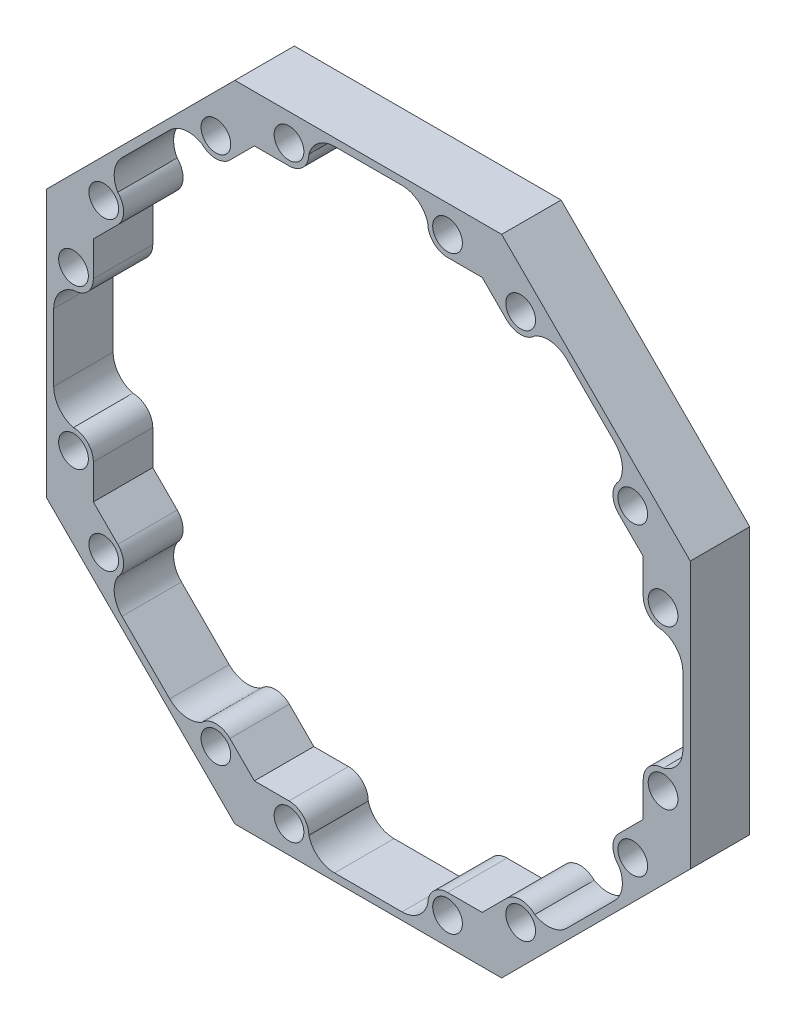
from build123d import *

# Parameters (mm, degrees)
RESSALTO_EXTRUS_O1_DEPTH = 2.5
ESBO_O4_R                = 3
ESBO_O4_R_2              = 0.6604
CORTE_EXTRUS_O1_DEPTH    = 5
ESBO_O5_W                = 2.8
ESBO_O5_H                = 2.8
CORTE_EXTRUS_O2_DEPTH    = 90.837353033
ESBO_O6_R                = 0.6604
CORTE_EXTRUS_O3_DEPTH    = 90.837353033
ESBO_O9_R                = 4
RESSALTO_EXTRUS_O2_DEPTH = 2.5
CORTE_EXTRUS_O4_DEPTH    = 90.837353033
ESBO_O11_R               = 4
CORTE_EXTRUS_O5_DEPTH    = 90.837353033
RESSALTO_EXTRUS_O4_DEPTH = 12
ESBO_O16_R               = 92.783472713
CORTE_EXTRUS_O9_DEPTH    = 12
CORTE_EXTRUS_O10_DEPTH   = 91.600772624
RESSALTO_EXTRUS_O5_DEPTH = 12
ESBO_O18_W               = 2.8
ESBO_O18_H               = 2.8
CORTE_EXTRUS_O13_DEPTH   = 91.600772624
CORTE_EXTRUS_O14_DEPTH   = 91.600772624
ESBO_O23_R               = 3
CORTE_EXTRUS_O16_DEPTH   = 5
ESBO_O24_W               = 24.000132914
ESBO_O24_H               = 6.832493105
ESBO_O24_W_2             = 6.832493105
ESBO_O24_H_2             = 24.000132914
CORTE_EXTRUS_O17_DEPTH   = 91.600772624
RESSALTO_EXTRUS_O6_DEPTH = 12
RESSALTO_EXTRUS_O7_DEPTH = 12


with BuildPart() as part:
    # Esboço1 → Ressalto-extrusão1 (new body)
    with BuildSketch(Plane.XY):
        Polygon((63.5, -26.302561211), (63.5, 26.302561211), (26.302561211, 63.5), (-26.302561211, 63.5), (-63.5, 26.302561211), (-63.5, -26.302561211), (-26.302561211, -63.5), (26.302561211, -63.5), align=None)
    extrude(amount=RESSALTO_EXTRUS_O1_DEPTH)

    # Esboço4 → Corte-extrusão1 (cut)
    with BuildSketch(Plane(origin=(0, 0, 0), x_dir=(-1, 0, 0), z_dir=(0, 0, -1))):
        Circle(ESBO_O4_R)
        with Locations((0, -12.88)):
            Circle(ESBO_O4_R_2)
        with Locations((0, 12.88)):
            Circle(ESBO_O4_R_2)
    extrude(amount=-CORTE_EXTRUS_O1_DEPTH, mode=Mode.SUBTRACT)

    # Esboço5 → Corte-extrusão2 (cut, through all)
    with BuildSketch(Plane.XY):
        Polygon((-47.72970773, -34.436100244), (-49.709606717, -36.415999231), (-47.72970773, -38.395898218), (-45.749808743, -36.415999231), align=None)
        Polygon((-42.072853481, -40.092954493), (-44.052752468, -42.072853481), (-42.072853481, -44.052752468), (-40.092954493, -42.072853481), align=None)
        Polygon((-53.38656198, -28.779245994), (-55.366460967, -30.759144982), (-53.38656198, -32.739043969), (-51.406662992, -30.759144982), align=None)
        Polygon((60.9, -25.225605949), (59.043416229, -27.082189719), (57.063517242, -25.102290732), (58.1, -24.065807974), (58.1, -22.6), (60.9, -22.6), align=None)
        with Locations((59.5, -8)):
            Rectangle(ESBO_O5_W, ESBO_O5_H)
        with Locations((59.5, -16)):
            Rectangle(ESBO_O5_W, ESBO_O5_H)
        Polygon((-30.759144982, -55.366460967), (-32.739043969, -53.38656198), (-30.759144982, -51.406662992), (-28.779245994, -53.38656198), align=None)
        Polygon((-36.415999231, -49.709606717), (-38.395898218, -47.72970773), (-36.415999231, -45.749808743), (-34.436100244, -47.72970773), align=None)
        Polygon((58.1, 24.065807974), (57.063517242, 25.102290732), (59.043416229, 27.082189719), (60.9, 25.225605949), (60.9, 22.6), (58.1, 22.6), align=None)
        with Locations((59.5, 16)):
            Rectangle(ESBO_O5_W, ESBO_O5_H)
        with Locations((59.5, 8)):
            Rectangle(ESBO_O5_W, ESBO_O5_H)
        with Locations((59.5, 0)):
            Rectangle(ESBO_O5_W, ESBO_O5_H)
        with Locations((8, 24)):
            Rectangle(ESBO_O5_W, ESBO_O5_H)
        Polygon((-25.225605949, -60.9), (-27.082189719, -59.043416229), (-25.102290732, -57.063517242), (-24.065807974, -58.1), (-22.6, -58.1), (-22.6, -60.9), align=None)
        with Locations((-8, -59.5)):
            Rectangle(ESBO_O5_W, ESBO_O5_H)
        with Locations((-16, -59.5)):
            Rectangle(ESBO_O5_W, ESBO_O5_H)
        Polygon((24.065807974, -58.1), (25.102290732, -57.063517242), (27.082189719, -59.043416229), (25.225605949, -60.9), (22.6, -60.9), (22.6, -58.1), align=None)
        with Locations((16, -59.5)):
            Rectangle(ESBO_O5_W, ESBO_O5_H)
        with Locations((8, -59.5)):
            Rectangle(ESBO_O5_W, ESBO_O5_H)
        with Locations((0, -59.5)):
            Rectangle(ESBO_O5_W, ESBO_O5_H)
        Polygon((34.436100244, -47.72970773), (36.415999231, -49.709606717), (38.395898218, -47.72970773), (36.415999231, -45.749808743), align=None)
        Polygon((40.092954493, -42.072853481), (42.072853481, -44.052752468), (44.052752468, -42.072853481), (42.072853481, -40.092954493), align=None)
        Polygon((28.779245994, -53.38656198), (30.759144982, -55.366460967), (32.739043969, -53.38656198), (30.759144982, -51.406662992), align=None)
        Polygon((-60.9, 25.225605949), (-59.043416229, 27.082189719), (-57.063517242, 25.102290732), (-58.1, 24.065807974), (-58.1, 22.6), (-60.9, 22.6), align=None)
        with Locations((-59.5, 8)):
            Rectangle(ESBO_O5_W, ESBO_O5_H)
        with Locations((-59.5, 16)):
            Rectangle(ESBO_O5_W, ESBO_O5_H)
        Polygon((55.366460967, -30.759144982), (53.38656198, -32.739043969), (51.406662992, -30.759144982), (53.38656198, -28.779245994), align=None)
        Polygon((49.709606717, -36.415999231), (47.72970773, -38.395898218), (45.749808743, -36.415999231), (47.72970773, -34.436100244), align=None)
        Polygon((-58.1, -24.065807974), (-57.063517242, -25.102290732), (-59.043416229, -27.082189719), (-60.9, -25.225605949), (-60.9, -22.6), (-58.1, -22.6), align=None)
        with Locations((-59.5, -16)):
            Rectangle(ESBO_O5_W, ESBO_O5_H)
        Polygon((47.72970773, 34.436100244), (49.709606717, 36.415999231), (47.72970773, 38.395898218), (45.749808743, 36.415999231), align=None)
        Polygon((42.072853481, 40.092954493), (44.052752468, 42.072853481), (42.072853481, 44.052752468), (40.092954493, 42.072853481), align=None)
        Polygon((53.38656198, 28.779245994), (55.366460967, 30.759144982), (53.38656198, 32.739043969), (51.406662992, 30.759144982), align=None)
        with Locations((-59.5, -8)):
            Rectangle(ESBO_O5_W, ESBO_O5_H)
        Polygon((25.225605949, 60.9), (27.082189719, 59.043416229), (25.102290732, 57.063517242), (24.065807974, 58.1), (22.6, 58.1), (22.6, 60.9), align=None)
        Polygon((30.759144982, 55.366460967), (32.739043969, 53.38656198), (30.759144982, 51.406662992), (28.779245994, 53.38656198), align=None)
        Polygon((36.415999231, 49.709606717), (38.395898218, 47.72970773), (36.415999231, 45.749808743), (34.436100244, 47.72970773), align=None)
        with Locations((8, 59.5)):
            Rectangle(ESBO_O5_W, ESBO_O5_H)
        with Locations((16, 59.5)):
            Rectangle(ESBO_O5_W, ESBO_O5_H)
        with Locations((-59.5, 0)):
            Rectangle(ESBO_O5_W, ESBO_O5_H)
        Polygon((-24.065807974, 58.1), (-25.102290732, 57.063517242), (-27.082189719, 59.043416229), (-25.225605949, 60.9), (-22.6, 60.9), (-22.6, 58.1), align=None)
        with Locations((-16, 59.5)):
            Rectangle(ESBO_O5_W, ESBO_O5_H)
        with Locations((-8, 59.5)):
            Rectangle(ESBO_O5_W, ESBO_O5_H)
        with Locations((0, 59.5)):
            Rectangle(ESBO_O5_W, ESBO_O5_H)
        Polygon((-34.436100244, 47.72970773), (-36.415999231, 49.709606717), (-38.395898218, 47.72970773), (-36.415999231, 45.749808743), align=None)
        Polygon((-40.092954493, 42.072853481), (-42.072853481, 44.052752468), (-44.052752468, 42.072853481), (-42.072853481, 40.092954493), align=None)
        Polygon((-28.779245994, 53.38656198), (-30.759144982, 55.366460967), (-32.739043969, 53.38656198), (-30.759144982, 51.406662992), align=None)
        Polygon((-55.366460967, 30.759144982), (-53.38656198, 32.739043969), (-51.406662992, 30.759144982), (-53.38656198, 28.779245994), align=None)
        Polygon((-49.709606717, 36.415999231), (-47.72970773, 38.395898218), (-45.749808743, 36.415999231), (-47.72970773, 34.436100244), align=None)
        Rectangle(ESBO_O5_W, ESBO_O5_H)
        with Locations((8, 0)):
            Rectangle(ESBO_O5_W, ESBO_O5_H)
        with Locations((16, 0)):
            Rectangle(ESBO_O5_W, ESBO_O5_H)
        with Locations((24, 0)):
            Rectangle(ESBO_O5_W, ESBO_O5_H)
        with Locations((-8, 24)):
            Rectangle(ESBO_O5_W, ESBO_O5_H)
        with Locations((-8, -24)):
            Rectangle(ESBO_O5_W, ESBO_O5_H)
        with Locations((8, -24)):
            Rectangle(ESBO_O5_W, ESBO_O5_H)
        with Locations((8, 8)):
            Rectangle(ESBO_O5_W, ESBO_O5_H)
        with Locations((16, 8)):
            Rectangle(ESBO_O5_W, ESBO_O5_H)
        with Locations((24, 8)):
            Rectangle(ESBO_O5_W, ESBO_O5_H)
        with Locations((40, 24)):
            Rectangle(ESBO_O5_W, ESBO_O5_H)
        with Locations((32, 24)):
            Rectangle(ESBO_O5_W, ESBO_O5_H)
        with Locations((8, 16)):
            Rectangle(ESBO_O5_W, ESBO_O5_H)
        with Locations((16, 16)):
            Rectangle(ESBO_O5_W, ESBO_O5_H)
        with Locations((24, 16)):
            Rectangle(ESBO_O5_W, ESBO_O5_H)
        with Locations((48, 24)):
            Rectangle(ESBO_O5_W, ESBO_O5_H)
        with Locations((40, 16)):
            Rectangle(ESBO_O5_W, ESBO_O5_H)
        with Locations((48, 16)):
            Rectangle(ESBO_O5_W, ESBO_O5_H)
        with Locations((40, 8)):
            Rectangle(ESBO_O5_W, ESBO_O5_H)
        with Locations((16, 24)):
            Rectangle(ESBO_O5_W, ESBO_O5_H)
        with Locations((24, 24)):
            Rectangle(ESBO_O5_W, ESBO_O5_H)
        with Locations((48, 8)):
            Rectangle(ESBO_O5_W, ESBO_O5_H)
        with Locations((40, 0)):
            Rectangle(ESBO_O5_W, ESBO_O5_H)
        with Locations((48, 0)):
            Rectangle(ESBO_O5_W, ESBO_O5_H)
        with Locations((8, 32)):
            Rectangle(ESBO_O5_W, ESBO_O5_H)
        with Locations((16, 32)):
            Rectangle(ESBO_O5_W, ESBO_O5_H)
        with Locations((24, 32)):
            Rectangle(ESBO_O5_W, ESBO_O5_H)
        with Locations((32, 32)):
            Rectangle(ESBO_O5_W, ESBO_O5_H)
        with Locations((40, 32)):
            Rectangle(ESBO_O5_W, ESBO_O5_H)
        with Locations((40, -8)):
            Rectangle(ESBO_O5_W, ESBO_O5_H)
        with Locations((8, 40)):
            Rectangle(ESBO_O5_W, ESBO_O5_H)
        with Locations((16, 40)):
            Rectangle(ESBO_O5_W, ESBO_O5_H)
        with Locations((24, 40)):
            Rectangle(ESBO_O5_W, ESBO_O5_H)
        with Locations((32, 40)):
            Rectangle(ESBO_O5_W, ESBO_O5_H)
        with Locations((48, -8)):
            Rectangle(ESBO_O5_W, ESBO_O5_H)
        with Locations((40, -16)):
            Rectangle(ESBO_O5_W, ESBO_O5_H)
        with Locations((8, 48)):
            Rectangle(ESBO_O5_W, ESBO_O5_H)
        with Locations((16, 48)):
            Rectangle(ESBO_O5_W, ESBO_O5_H)
        with Locations((24, 48)):
            Rectangle(ESBO_O5_W, ESBO_O5_H)
        with Locations((48, -16)):
            Rectangle(ESBO_O5_W, ESBO_O5_H)
        with Locations((40, -24)):
            Rectangle(ESBO_O5_W, ESBO_O5_H)
        with Locations((48, -24)):
            Rectangle(ESBO_O5_W, ESBO_O5_H)
        with Locations((0, 8)):
            Rectangle(ESBO_O5_W, ESBO_O5_H)
        with Locations((0, 16)):
            Rectangle(ESBO_O5_W, ESBO_O5_H)
        with Locations((0, 24)):
            Rectangle(ESBO_O5_W, ESBO_O5_H)
        with Locations((0, 32)):
            Rectangle(ESBO_O5_W, ESBO_O5_H)
        with Locations((0, 40)):
            Rectangle(ESBO_O5_W, ESBO_O5_H)
        with Locations((0, 48)):
            Rectangle(ESBO_O5_W, ESBO_O5_H)
        with Locations((32, 16)):
            Rectangle(ESBO_O5_W, ESBO_O5_H)
        with Locations((-24, 48)):
            Rectangle(ESBO_O5_W, ESBO_O5_H)
        with Locations((-16, 48)):
            Rectangle(ESBO_O5_W, ESBO_O5_H)
        with Locations((-8, 48)):
            Rectangle(ESBO_O5_W, ESBO_O5_H)
        with Locations((-32, 40)):
            Rectangle(ESBO_O5_W, ESBO_O5_H)
        with Locations((-24, 40)):
            Rectangle(ESBO_O5_W, ESBO_O5_H)
        with Locations((-16, 40)):
            Rectangle(ESBO_O5_W, ESBO_O5_H)
        with Locations((-8, 40)):
            Rectangle(ESBO_O5_W, ESBO_O5_H)
        with Locations((32, 8)):
            Rectangle(ESBO_O5_W, ESBO_O5_H)
        with Locations((-40, 32)):
            Rectangle(ESBO_O5_W, ESBO_O5_H)
        with Locations((-32, 32)):
            Rectangle(ESBO_O5_W, ESBO_O5_H)
        with Locations((-24, 32)):
            Rectangle(ESBO_O5_W, ESBO_O5_H)
        with Locations((-16, 32)):
            Rectangle(ESBO_O5_W, ESBO_O5_H)
        with Locations((-8, 32)):
            Rectangle(ESBO_O5_W, ESBO_O5_H)
        with Locations((-24, 24)):
            Rectangle(ESBO_O5_W, ESBO_O5_H)
        with Locations((-16, 24)):
            Rectangle(ESBO_O5_W, ESBO_O5_H)
        with Locations((-24, 16)):
            Rectangle(ESBO_O5_W, ESBO_O5_H)
        with Locations((-16, 16)):
            Rectangle(ESBO_O5_W, ESBO_O5_H)
        with Locations((-8, 16)):
            Rectangle(ESBO_O5_W, ESBO_O5_H)
        with Locations((-24, 8)):
            Rectangle(ESBO_O5_W, ESBO_O5_H)
        with Locations((32, 0)):
            Rectangle(ESBO_O5_W, ESBO_O5_H)
        with Locations((-8, 8)):
            Rectangle(ESBO_O5_W, ESBO_O5_H)
        with Locations((-24, 0)):
            Rectangle(ESBO_O5_W, ESBO_O5_H)
        with Locations((32, -8)):
            Rectangle(ESBO_O5_W, ESBO_O5_H)
        with Locations((-8, 0)):
            Rectangle(ESBO_O5_W, ESBO_O5_H)
        with Locations((32, -16)):
            Rectangle(ESBO_O5_W, ESBO_O5_H)
        with Locations((40, -32)):
            Rectangle(ESBO_O5_W, ESBO_O5_H)
        with Locations((32, -24)):
            Rectangle(ESBO_O5_W, ESBO_O5_H)
        with Locations((-40, -32)):
            Rectangle(ESBO_O5_W, ESBO_O5_H)
        with Locations((32, -32)):
            Rectangle(ESBO_O5_W, ESBO_O5_H)
        with Locations((-8, -8)):
            Rectangle(ESBO_O5_W, ESBO_O5_H)
        with Locations((-24, -8)):
            Rectangle(ESBO_O5_W, ESBO_O5_H)
        with Locations((-8, -16)):
            Rectangle(ESBO_O5_W, ESBO_O5_H)
        with Locations((-16, -16)):
            Rectangle(ESBO_O5_W, ESBO_O5_H)
        with Locations((-24, -16)):
            Rectangle(ESBO_O5_W, ESBO_O5_H)
        with Locations((-16, -24)):
            Rectangle(ESBO_O5_W, ESBO_O5_H)
        with Locations((-24, -24)):
            Rectangle(ESBO_O5_W, ESBO_O5_H)
        with Locations((-8, -32)):
            Rectangle(ESBO_O5_W, ESBO_O5_H)
        with Locations((-16, -32)):
            Rectangle(ESBO_O5_W, ESBO_O5_H)
        with Locations((-24, -32)):
            Rectangle(ESBO_O5_W, ESBO_O5_H)
        with Locations((24, -40)):
            Rectangle(ESBO_O5_W, ESBO_O5_H)
        with Locations((-8, -40)):
            Rectangle(ESBO_O5_W, ESBO_O5_H)
        with Locations((-16, -40)):
            Rectangle(ESBO_O5_W, ESBO_O5_H)
        with Locations((-32, -40)):
            Rectangle(ESBO_O5_W, ESBO_O5_H)
        with Locations((-8, -48)):
            Rectangle(ESBO_O5_W, ESBO_O5_H)
        with Locations((-16, -48)):
            Rectangle(ESBO_O5_W, ESBO_O5_H)
        with Locations((-24, -48)):
            Rectangle(ESBO_O5_W, ESBO_O5_H)
        with Locations((0, -48)):
            Rectangle(ESBO_O5_W, ESBO_O5_H)
        with Locations((0, -40)):
            Rectangle(ESBO_O5_W, ESBO_O5_H)
        with Locations((0, -32)):
            Rectangle(ESBO_O5_W, ESBO_O5_H)
        with Locations((0, -24)):
            Rectangle(ESBO_O5_W, ESBO_O5_H)
        with Locations((0, -16)):
            Rectangle(ESBO_O5_W, ESBO_O5_H)
        with Locations((0, -8)):
            Rectangle(ESBO_O5_W, ESBO_O5_H)
        with Locations((-24, -40)):
            Rectangle(ESBO_O5_W, ESBO_O5_H)
        with Locations((24, -48)):
            Rectangle(ESBO_O5_W, ESBO_O5_H)
        with Locations((16, -48)):
            Rectangle(ESBO_O5_W, ESBO_O5_H)
        with Locations((8, -48)):
            Rectangle(ESBO_O5_W, ESBO_O5_H)
        with Locations((32, -40)):
            Rectangle(ESBO_O5_W, ESBO_O5_H)
        with Locations((16, -40)):
            Rectangle(ESBO_O5_W, ESBO_O5_H)
        with Locations((8, -40)):
            Rectangle(ESBO_O5_W, ESBO_O5_H)
        with Locations((-32, -32)):
            Rectangle(ESBO_O5_W, ESBO_O5_H)
        with Locations((24, -32)):
            Rectangle(ESBO_O5_W, ESBO_O5_H)
        with Locations((16, -32)):
            Rectangle(ESBO_O5_W, ESBO_O5_H)
        with Locations((8, -32)):
            Rectangle(ESBO_O5_W, ESBO_O5_H)
        with Locations((24, -24)):
            Rectangle(ESBO_O5_W, ESBO_O5_H)
        with Locations((16, -24)):
            Rectangle(ESBO_O5_W, ESBO_O5_H)
        with Locations((24, -16)):
            Rectangle(ESBO_O5_W, ESBO_O5_H)
        with Locations((16, -16)):
            Rectangle(ESBO_O5_W, ESBO_O5_H)
        with Locations((8, -16)):
            Rectangle(ESBO_O5_W, ESBO_O5_H)
        with Locations((24, -8)):
            Rectangle(ESBO_O5_W, ESBO_O5_H)
        with Locations((16, -8)):
            Rectangle(ESBO_O5_W, ESBO_O5_H)
        with Locations((8, -8)):
            Rectangle(ESBO_O5_W, ESBO_O5_H)
        with Locations((-32, -24)):
            Rectangle(ESBO_O5_W, ESBO_O5_H)
        with Locations((-32, -16)):
            Rectangle(ESBO_O5_W, ESBO_O5_H)
        with Locations((-32, 16)):
            Rectangle(ESBO_O5_W, ESBO_O5_H)
        with Locations((-48, -24)):
            Rectangle(ESBO_O5_W, ESBO_O5_H)
        with Locations((-40, -24)):
            Rectangle(ESBO_O5_W, ESBO_O5_H)
        with Locations((-48, -16)):
            Rectangle(ESBO_O5_W, ESBO_O5_H)
        with Locations((-40, -16)):
            Rectangle(ESBO_O5_W, ESBO_O5_H)
        with Locations((-48, -8)):
            Rectangle(ESBO_O5_W, ESBO_O5_H)
        with Locations((-40, -8)):
            Rectangle(ESBO_O5_W, ESBO_O5_H)
        with Locations((-48, 0)):
            Rectangle(ESBO_O5_W, ESBO_O5_H)
        with Locations((-40, 0)):
            Rectangle(ESBO_O5_W, ESBO_O5_H)
        with Locations((-48, 8)):
            Rectangle(ESBO_O5_W, ESBO_O5_H)
        with Locations((-40, 8)):
            Rectangle(ESBO_O5_W, ESBO_O5_H)
        with Locations((-48, 16)):
            Rectangle(ESBO_O5_W, ESBO_O5_H)
        with Locations((-40, 16)):
            Rectangle(ESBO_O5_W, ESBO_O5_H)
        with Locations((-48, 24)):
            Rectangle(ESBO_O5_W, ESBO_O5_H)
        with Locations((-40, 24)):
            Rectangle(ESBO_O5_W, ESBO_O5_H)
        with Locations((-32, 24)):
            Rectangle(ESBO_O5_W, ESBO_O5_H)
        with Locations((-32, 8)):
            Rectangle(ESBO_O5_W, ESBO_O5_H)
        with Locations((-32, 0)):
            Rectangle(ESBO_O5_W, ESBO_O5_H)
        with Locations((-32, -8)):
            Rectangle(ESBO_O5_W, ESBO_O5_H)
        with Locations((-16, 8)):
            Rectangle(ESBO_O5_W, ESBO_O5_H)
        with Locations((-16, 0)):
            Rectangle(ESBO_O5_W, ESBO_O5_H)
        with Locations((-16, -8)):
            Rectangle(ESBO_O5_W, ESBO_O5_H)
    extrude(amount=CORTE_EXTRUS_O2_DEPTH, mode=Mode.SUBTRACT)

    # Esboço6 → Corte-extrusão3 (cut, through all)
    with BuildSketch(Plane.XY.offset(2.5)):
        with Locations((12.8778, 0)):
            Circle(ESBO_O6_R)
        with Locations((-12.8778, 0)):
            Circle(ESBO_O6_R)
    extrude(amount=-CORTE_EXTRUS_O3_DEPTH, mode=Mode.SUBTRACT)

    # Esboço9 → Ressalto-extrusão2 (add)
    with BuildSketch(Plane(origin=(0, 0, 0), x_dir=(-1, 0, 0), z_dir=(0, 0, -1))):
        with Locations((-40, -24)):
            Circle(ESBO_O9_R)
        with Locations((-32, -32)):
            Circle(ESBO_O9_R)
        with Locations((-24, -40)):
            Circle(ESBO_O9_R)
        with Locations((-24, 40)):
            Circle(ESBO_O9_R)
        with Locations((-32, 32)):
            Circle(ESBO_O9_R)
        with Locations((-40, 24)):
            Circle(ESBO_O9_R)
        with Locations((40, 24)):
            Circle(ESBO_O9_R)
        with Locations((32, 32)):
            Circle(ESBO_O9_R)
        with Locations((24, 40)):
            Circle(ESBO_O9_R)
        with Locations((24, -40)):
            Circle(ESBO_O9_R)
        with Locations((32, -32)):
            Circle(ESBO_O9_R)
        with Locations((40, -24)):
            Circle(ESBO_O9_R)
    extrude(amount=-RESSALTO_EXTRUS_O2_DEPTH)

    # Esboço7 → Corte-extrusão4 (cut, through all)
    with BuildSketch(Plane(origin=(0, 0, 0), x_dir=(-1, 0, 0), z_dir=(0, 0, -1))):
        Polygon((30.228814896, 47.199377644), (47.199377644, 30.228814896), (40.128309832, 23.157747084), (23.157747084, 40.128309832), align=None)
        Polygon((26.30437226, 28.284271247), (28.284271247, 30.264170235), (30.264170235, 28.284271247), (28.284271247, 26.30437226), align=None)
        Polygon((-47.199377644, 30.228814896), (-30.228814896, 47.199377644), (-23.157747084, 40.128309832), (-40.128309832, 23.157747084), align=None)
        Polygon((47.199377644, -30.228814896), (30.228814896, -47.199377644), (23.157747084, -40.128309832), (40.128309832, -23.157747084), align=None)
        Polygon((-30.228814896, -47.199377644), (-47.199377644, -30.228814896), (-40.128309832, -23.157747084), (-23.157747084, -40.128309832), align=None)
        Polygon((-28.284271247, 26.30437226), (-30.264170235, 28.284271247), (-28.284271247, 30.264170235), (-26.30437226, 28.284271247), align=None)
        Polygon((28.284271247, -26.30437226), (30.264170235, -28.284271247), (28.284271247, -30.264170235), (26.30437226, -28.284271247), align=None)
        Polygon((-26.30437226, -28.284271247), (-28.284271247, -30.264170235), (-30.264170235, -28.284271247), (-28.284271247, -26.30437226), align=None)
    extrude(amount=-CORTE_EXTRUS_O4_DEPTH, mode=Mode.SUBTRACT)

    # Esboço11 → Corte-extrusão5 (cut, through all)
    with BuildSketch(Plane(origin=(0, 0, 0), x_dir=(-1, 0, 0), z_dir=(0, 0, -1))):
        with Locations((0, -40)):
            Circle(ESBO_O11_R)
    extrude(amount=-CORTE_EXTRUS_O5_DEPTH, mode=Mode.SUBTRACT)

    # Esboço16 → Corte-extrusão9 (cut)
    with BuildSketch(Plane(origin=(0, 0, 0), x_dir=(-1, 0, 0), z_dir=(0, 0, -1))):
        Circle(ESBO_O16_R)
    extrude(amount=-CORTE_EXTRUS_O9_DEPTH, mode=Mode.SUBTRACT)


with BuildPart() as body_2:
    # Esboço14 → Ressalto-extrusão4 (new body)
    with BuildSketch(Plane(origin=(0, 0, 0), x_dir=(-1, 0, 0), z_dir=(0, 0, -1))):
        Polygon((63.5, -26.302561211), (63.5, 26.302561211), (26.302561211, 63.5), (-26.302561211, 63.5), (-63.5, 26.302561211), (-63.5, -26.302561211), (-26.302561211, -63.5), (26.302561211, -63.5), align=None)
        Polygon((24.065807974, -58.1), (58.1, -24.065807974), (58.1, 24.065807974), (24.065807974, 58.1), (-24.065807974, 58.1), (-58.1, 24.065807974), (-58.1, -24.065807974), (-24.065807974, -58.1), align=None, mode=Mode.SUBTRACT)
    extrude(amount=RESSALTO_EXTRUS_O4_DEPTH)

    # Esboço17 → Corte-extrusão10 (cut, through all)
    with BuildSketch(Plane.XY):
        with BuildLine():
            Line((0, -62.5), (-8, -62.5))
            ThreePointArc((-8, -62.5), (-10.121320344, -61.621320344), (-11, -59.5))
            Line((-11, -59.5), (-11, -56.5))
            Line((-11, -56.5), (-8, -56.5))
            Line((-8, -56.5), (0, -56.5))
            Line((0, -56.5), (8, -56.5))
            Line((8, -56.5), (11, -56.5))
            Line((11, -56.5), (11, -59.5))
            ThreePointArc((11, -59.5), (10.121320344, -61.621320344), (8, -62.5))
            Line((8, -62.5), (0, -62.5))
        make_face()
        with BuildLine():
            Line((-44.194173824, -44.194173824), (-49.851028074, -38.537319575))
            ThreePointArc((-49.851028074, -38.537319575), (-50.72970773, -36.415999231), (-49.851028074, -34.294678888))
            Line((-49.851028074, -34.294678888), (-47.72970773, -32.173358544))
            Line((-47.72970773, -32.173358544), (-45.608387387, -34.294678888))
            Line((-45.608387387, -34.294678888), (-39.951533137, -39.951533137))
            Line((-39.951533137, -39.951533137), (-34.294678888, -45.608387387))
            Line((-34.294678888, -45.608387387), (-32.173358544, -47.72970773))
            Line((-32.173358544, -47.72970773), (-34.294678888, -49.851028074))
            ThreePointArc((-34.294678888, -49.851028074), (-36.415999231, -50.72970773), (-38.537319575, -49.851028074))
            Line((-38.537319575, -49.851028074), (-44.194173824, -44.194173824))
        make_face()
        with BuildLine():
            Line((-62.5, 0), (-62.5, 8))
            ThreePointArc((-62.5, 8), (-61.621320344, 10.121320344), (-59.5, 11))
            Line((-59.5, 11), (-56.5, 11))
            Line((-56.5, 11), (-56.5, 8))
            Line((-56.5, 8), (-56.5, 0))
            Line((-56.5, 0), (-56.5, -8))
            Line((-56.5, -8), (-56.5, -11))
            Line((-56.5, -11), (-59.5, -11))
            ThreePointArc((-59.5, -11), (-61.621320344, -10.121320344), (-62.5, -8))
            Line((-62.5, -8), (-62.5, 0))
        make_face()
        with BuildLine():
            Line((-44.194173824, 44.194173824), (-38.537319575, 49.851028074))
            ThreePointArc((-38.537319575, 49.851028074), (-36.415999231, 50.72970773), (-34.294678888, 49.851028074))
            Line((-34.294678888, 49.851028074), (-32.173358544, 47.72970773))
            Line((-32.173358544, 47.72970773), (-34.294678888, 45.608387387))
            Line((-34.294678888, 45.608387387), (-39.951533137, 39.951533137))
            Line((-39.951533137, 39.951533137), (-45.608387387, 34.294678888))
            Line((-45.608387387, 34.294678888), (-47.72970773, 32.173358544))
            Line((-47.72970773, 32.173358544), (-49.851028074, 34.294678888))
            ThreePointArc((-49.851028074, 34.294678888), (-50.72970773, 36.415999231), (-49.851028074, 38.537319575))
            Line((-49.851028074, 38.537319575), (-44.194173824, 44.194173824))
        make_face()
        with BuildLine():
            Line((0, 62.5), (8, 62.5))
            ThreePointArc((8, 62.5), (10.121320344, 61.621320344), (11, 59.5))
            Line((11, 59.5), (11, 56.5))
            Line((11, 56.5), (8, 56.5))
            Line((8, 56.5), (0, 56.5))
            Line((0, 56.5), (-8, 56.5))
            Line((-8, 56.5), (-11, 56.5))
            Line((-11, 56.5), (-11, 59.5))
            ThreePointArc((-11, 59.5), (-10.121320344, 61.621320344), (-8, 62.5))
            Line((-8, 62.5), (0, 62.5))
        make_face()
        with BuildLine():
            Line((44.194173824, 44.194173824), (49.851028074, 38.537319575))
            ThreePointArc((49.851028074, 38.537319575), (50.72970773, 36.415999231), (49.851028074, 34.294678888))
            Line((49.851028074, 34.294678888), (47.72970773, 32.173358544))
            Line((47.72970773, 32.173358544), (45.608387387, 34.294678888))
            Line((45.608387387, 34.294678888), (39.951533137, 39.951533137))
            Line((39.951533137, 39.951533137), (34.294678888, 45.608387387))
            Line((34.294678888, 45.608387387), (32.173358544, 47.72970773))
            Line((32.173358544, 47.72970773), (34.294678888, 49.851028074))
            ThreePointArc((34.294678888, 49.851028074), (36.415999231, 50.72970773), (38.537319575, 49.851028074))
            Line((38.537319575, 49.851028074), (44.194173824, 44.194173824))
        make_face()
        with BuildLine():
            Line((62.5, 0), (62.5, -8))
            ThreePointArc((62.5, -8), (61.621320344, -10.121320344), (59.5, -11))
            Line((59.5, -11), (56.5, -11))
            Line((56.5, -11), (56.5, -8))
            Line((56.5, -8), (56.5, 0))
            Line((56.5, 0), (56.5, 8))
            Line((56.5, 8), (56.5, 11))
            Line((56.5, 11), (59.5, 11))
            ThreePointArc((59.5, 11), (61.621320344, 10.121320344), (62.5, 8))
            Line((62.5, 8), (62.5, 0))
        make_face()
        with BuildLine():
            Line((44.194173824, -44.194173824), (38.537319575, -49.851028074))
            ThreePointArc((38.537319575, -49.851028074), (36.415999231, -50.72970773), (34.294678888, -49.851028074))
            Line((34.294678888, -49.851028074), (32.173358544, -47.72970773))
            Line((32.173358544, -47.72970773), (34.294678888, -45.608387387))
            Line((34.294678888, -45.608387387), (39.951533137, -39.951533137))
            Line((39.951533137, -39.951533137), (45.608387387, -34.294678888))
            Line((45.608387387, -34.294678888), (47.72970773, -32.173358544))
            Line((47.72970773, -32.173358544), (49.851028074, -34.294678888))
            ThreePointArc((49.851028074, -34.294678888), (50.72970773, -36.415999231), (49.851028074, -38.537319575))
            Line((49.851028074, -38.537319575), (44.194173824, -44.194173824))
        make_face()
    extrude(amount=-CORTE_EXTRUS_O10_DEPTH, mode=Mode.SUBTRACT)

    # Esboço20 → Ressalto-extrusão5 (add, through all)
    with BuildSketch(Plane.XY):
        with BuildLine():
            Line((-16, -55.5), (-22.988852712, -55.5))
            Line((-22.988852712, -55.5), (-27.930717857, -50.558134855))
            ThreePointArc((-27.930717857, -50.558134855), (-33.587572106, -50.558134855), (-33.587572106, -56.214989104))
            Line((-33.587572106, -56.214989104), (-26.302561211, -63.5))
            Line((-26.302561211, -63.5), (-16, -63.5))
            ThreePointArc((-16, -63.5), (-12, -59.5), (-16, -55.5))
        make_face()
        with BuildLine():
            Line((-50.558134855, -27.930717857), (-55.5, -22.988852712))
            Line((-55.5, -22.988852712), (-55.5, -16))
            ThreePointArc((-55.5, -16), (-59.5, -12), (-63.5, -16))
            Line((-63.5, -16), (-63.5, -26.302561211))
            Line((-63.5, -26.302561211), (-56.214989104, -33.587572106))
            ThreePointArc((-56.214989104, -33.587572106), (-50.558134855, -33.587572106), (-50.558134855, -27.930717857))
        make_face()
        with BuildLine():
            Line((-55.5, 16), (-55.5, 22.988852712))
            Line((-55.5, 22.988852712), (-50.558134855, 27.930717857))
            ThreePointArc((-50.558134855, 27.930717857), (-50.558134855, 33.587572106), (-56.214989104, 33.587572106))
            Line((-56.214989104, 33.587572106), (-63.5, 26.302561211))
            Line((-63.5, 26.302561211), (-63.5, 16))
            ThreePointArc((-63.5, 16), (-59.5, 12), (-55.5, 16))
        make_face()
        with BuildLine():
            Line((-27.930717857, 50.558134855), (-22.988852712, 55.5))
            Line((-22.988852712, 55.5), (-16, 55.5))
            ThreePointArc((-16, 55.5), (-12, 59.5), (-16, 63.5))
            Line((-16, 63.5), (-26.302561211, 63.5))
            Line((-26.302561211, 63.5), (-33.587572106, 56.214989104))
            ThreePointArc((-33.587572106, 56.214989104), (-33.587572106, 50.558134855), (-27.930717857, 50.558134855))
        make_face()
        with BuildLine():
            Line((16, 55.5), (22.988852712, 55.5))
            Line((22.988852712, 55.5), (27.930717857, 50.558134855))
            ThreePointArc((27.930717857, 50.558134855), (33.587572106, 50.558134855), (33.587572106, 56.214989104))
            Line((33.587572106, 56.214989104), (26.302561211, 63.5))
            Line((26.302561211, 63.5), (16, 63.5))
            ThreePointArc((16, 63.5), (12, 59.5), (16, 55.5))
        make_face()
        with BuildLine():
            Line((50.558134855, 27.930717857), (55.5, 22.988852712))
            Line((55.5, 22.988852712), (55.5, 16))
            ThreePointArc((55.5, 16), (59.5, 12), (63.5, 16))
            Line((63.5, 16), (63.5, 26.302561211))
            Line((63.5, 26.302561211), (56.214989104, 33.587572106))
            ThreePointArc((56.214989104, 33.587572106), (50.558134855, 33.587572106), (50.558134855, 27.930717857))
        make_face()
        with BuildLine():
            Line((55.5, -16), (55.5, -22.988852712))
            Line((55.5, -22.988852712), (50.558134855, -27.930717857))
            ThreePointArc((50.558134855, -27.930717857), (50.558134855, -33.587572106), (56.214989104, -33.587572106))
            Line((56.214989104, -33.587572106), (63.5, -26.302561211))
            Line((63.5, -26.302561211), (63.5, -16))
            ThreePointArc((63.5, -16), (59.5, -12), (55.5, -16))
        make_face()
        with BuildLine():
            Line((27.930717857, -50.558134855), (22.988852712, -55.5))
            Line((22.988852712, -55.5), (16, -55.5))
            ThreePointArc((16, -55.5), (12, -59.5), (16, -63.5))
            Line((16, -63.5), (26.302561211, -63.5))
            Line((26.302561211, -63.5), (33.587572106, -56.214989104))
            ThreePointArc((33.587572106, -56.214989104), (33.587572106, -50.558134855), (27.930717857, -50.558134855))
        make_face()
    extrude(amount=-RESSALTO_EXTRUS_O5_DEPTH)

    # Esboço18 → Corte-extrusão13 (cut, through all)
    with BuildSketch(Plane.XY):
        with Locations((-16, -59.5)):
            Rectangle(ESBO_O18_W, ESBO_O18_H)
        Polygon((-32.739043969, -53.38656198), (-30.759144982, -51.406662992), (-28.779245994, -53.38656198), (-30.759144982, -55.366460967), align=None)
        with Locations((-59.5, -16)):
            Rectangle(ESBO_O18_W, ESBO_O18_H)
        Polygon((-55.366460967, -30.759144982), (-53.38656198, -32.739043969), (-51.406662992, -30.759144982), (-53.38656198, -28.779245994), align=None)
        Polygon((-53.38656198, 32.739043969), (-51.406662992, 30.759144982), (-53.38656198, 28.779245994), (-55.366460967, 30.759144982), align=None)
        with Locations((-59.5, 16)):
            Rectangle(ESBO_O18_W, ESBO_O18_H)
        with Locations((-16, 59.5)):
            Rectangle(ESBO_O18_W, ESBO_O18_H)
        Polygon((-30.759144982, 55.366460967), (-32.739043969, 53.38656198), (-30.759144982, 51.406662992), (-28.779245994, 53.38656198), align=None)
        Polygon((32.739043969, 53.38656198), (30.759144982, 51.406662992), (28.779245994, 53.38656198), (30.759144982, 55.366460967), align=None)
        with Locations((16, 59.5)):
            Rectangle(ESBO_O18_W, ESBO_O18_H)
        with Locations((59.5, 16)):
            Rectangle(ESBO_O18_W, ESBO_O18_H)
        Polygon((55.366460967, 30.759144982), (53.38656198, 32.739043969), (51.406662992, 30.759144982), (53.38656198, 28.779245994), align=None)
        Polygon((53.38656198, -32.739043969), (51.406662992, -30.759144982), (53.38656198, -28.779245994), (55.366460967, -30.759144982), align=None)
        with Locations((59.5, -16)):
            Rectangle(ESBO_O18_W, ESBO_O18_H)
        with Locations((16, -59.5)):
            Rectangle(ESBO_O18_W, ESBO_O18_H)
        Polygon((30.759144982, -55.366460967), (32.739043969, -53.38656198), (30.759144982, -51.406662992), (28.779245994, -53.38656198), align=None)
    extrude(amount=-CORTE_EXTRUS_O13_DEPTH, mode=Mode.SUBTRACT)

    # Esboço22 → Corte-extrusão14 (cut, through all)
    with BuildSketch(Plane(origin=(0, 0, -12), x_dir=(-1, 0, 0), z_dir=(0, 0, -1))):
        with BuildLine():
            Line((62.5, 9.040235234), (62.5, -9.040235234))
            ThreePointArc((62.5, -9.040235234), (61.627030069, -11.139210383), (59.523057638, -12.000066457))
            ThreePointArc((59.523057638, -12.000066457), (56.679736763, -13.163432484), (55.5, -16))
            Line((55.5, -16), (55.5, 16))
            ThreePointArc((55.5, 16), (56.679736763, 13.163432484), (59.523057638, 12.000066457))
            ThreePointArc((59.523057638, 12.000066457), (61.627030069, 11.139210383), (62.5, 9.040235234))
        make_face()
        with BuildLine():
            Line((50.586585462, -37.801762186), (37.801762186, -50.586585462))
            ThreePointArc((37.801762186, -50.586585462), (35.700279668, -51.453502065), (33.603829326, -50.574486059))
            ThreePointArc((33.603829326, -50.574486059), (30.770673848, -49.386578594), (27.930717857, -50.558134855))
            Line((27.930717857, -50.558134855), (50.558134855, -27.930717857))
            ThreePointArc((50.558134855, -27.930717857), (49.386578594, -30.770673848), (50.574486059, -33.603829326))
            ThreePointArc((50.574486059, -33.603829326), (51.453502065, -35.700279668), (50.586585462, -37.801762186))
        make_face()
        with BuildLine():
            Line((9.040235234, -62.5), (-9.040235234, -62.5))
            ThreePointArc((-9.040235234, -62.5), (-11.139210383, -61.627030069), (-12.000066457, -59.523057638))
            ThreePointArc((-12.000066457, -59.523057638), (-13.163432484, -56.679736763), (-16, -55.5))
            Line((-16, -55.5), (16, -55.5))
            ThreePointArc((16, -55.5), (13.163432484, -56.679736763), (12.000066457, -59.523057638))
            ThreePointArc((12.000066457, -59.523057638), (11.139210383, -61.627030069), (9.040235234, -62.5))
        make_face()
        with BuildLine():
            Line((-37.801762186, -50.586585462), (-50.586585462, -37.801762186))
            ThreePointArc((-50.586585462, -37.801762186), (-51.453502065, -35.700279668), (-50.574486059, -33.603829326))
            ThreePointArc((-50.574486059, -33.603829326), (-49.386578594, -30.770673848), (-50.558134855, -27.930717857))
            Line((-50.558134855, -27.930717857), (-27.930717857, -50.558134855))
            ThreePointArc((-27.930717857, -50.558134855), (-30.770673848, -49.386578594), (-33.603829326, -50.574486059))
            ThreePointArc((-33.603829326, -50.574486059), (-35.700279668, -51.453502065), (-37.801762186, -50.586585462))
        make_face()
        with BuildLine():
            Line((-62.5, -9.040235234), (-62.5, 9.040235234))
            ThreePointArc((-62.5, 9.040235234), (-61.627030069, 11.139210383), (-59.523057638, 12.000066457))
            ThreePointArc((-59.523057638, 12.000066457), (-56.679736763, 13.163432484), (-55.5, 16))
            Line((-55.5, 16), (-55.5, -16))
            ThreePointArc((-55.5, -16), (-56.679736763, -13.163432484), (-59.523057638, -12.000066457))
            ThreePointArc((-59.523057638, -12.000066457), (-61.627030069, -11.139210383), (-62.5, -9.040235234))
        make_face()
        with BuildLine():
            Line((-50.586585462, 37.801762186), (-37.801762186, 50.586585462))
            ThreePointArc((-37.801762186, 50.586585462), (-35.700279668, 51.453502065), (-33.603829326, 50.574486059))
            ThreePointArc((-33.603829326, 50.574486059), (-30.770673848, 49.386578594), (-27.930717857, 50.558134855))
            Line((-27.930717857, 50.558134855), (-50.558134855, 27.930717857))
            ThreePointArc((-50.558134855, 27.930717857), (-49.386578594, 30.770673848), (-50.574486059, 33.603829326))
            ThreePointArc((-50.574486059, 33.603829326), (-51.453502065, 35.700279668), (-50.586585462, 37.801762186))
        make_face()
        with BuildLine():
            Line((-9.040235234, 62.5), (9.040235234, 62.5))
            ThreePointArc((9.040235234, 62.5), (11.139210383, 61.627030069), (12.000066457, 59.523057638))
            ThreePointArc((12.000066457, 59.523057638), (13.163432484, 56.679736763), (16, 55.5))
            Line((16, 55.5), (-16, 55.5))
            ThreePointArc((-16, 55.5), (-13.163432484, 56.679736763), (-12.000066457, 59.523057638))
            ThreePointArc((-12.000066457, 59.523057638), (-11.139210383, 61.627030069), (-9.040235234, 62.5))
        make_face()
        with BuildLine():
            Line((37.801762186, 50.586585462), (50.586585462, 37.801762186))
            ThreePointArc((50.586585462, 37.801762186), (51.453502065, 35.700279668), (50.574486059, 33.603829326))
            ThreePointArc((50.574486059, 33.603829326), (49.386578594, 30.770673848), (50.558134855, 27.930717857))
            Line((50.558134855, 27.930717857), (27.930717857, 50.558134855))
            ThreePointArc((27.930717857, 50.558134855), (30.770673848, 49.386578594), (33.603829326, 50.574486059))
            ThreePointArc((33.603829326, 50.574486059), (35.700279668, 51.453502065), (37.801762186, 50.586585462))
        make_face()
    extrude(amount=-CORTE_EXTRUS_O14_DEPTH, mode=Mode.SUBTRACT)

    # Esboço23 → Corte-extrusão16 (cut)
    with BuildSketch(Plane(origin=(0, 0, 0), x_dir=(-1, 0, 0), z_dir=(0, 0, -1))):
        with Locations((-59.5, -16)):
            Circle(ESBO_O23_R)
        with Locations((-53.38656198, -30.759144982)):
            Circle(ESBO_O23_R)
        with Locations((-59.5, 16)):
            Circle(ESBO_O23_R)
        with Locations((-53.38656198, 30.759144982)):
            Circle(ESBO_O23_R)
        with Locations((-30.759144982, 53.38656198)):
            Circle(ESBO_O23_R)
        with Locations((-16, 59.5)):
            Circle(ESBO_O23_R)
        with Locations((16, 59.5)):
            Circle(ESBO_O23_R)
        with Locations((30.759144982, 53.38656198)):
            Circle(ESBO_O23_R)
        with Locations((53.38656198, 30.759144982)):
            Circle(ESBO_O23_R)
        with Locations((59.5, 16)):
            Circle(ESBO_O23_R)
        with Locations((59.5, -16)):
            Circle(ESBO_O23_R)
        with Locations((53.38656198, -30.759144982)):
            Circle(ESBO_O23_R)
        with Locations((30.759144982, -53.38656198)):
            Circle(ESBO_O23_R)
        with Locations((16, -59.5)):
            Circle(ESBO_O23_R)
        with Locations((-16, -59.5)):
            Circle(ESBO_O23_R)
        with Locations((-30.759144982, -53.38656198)):
            Circle(ESBO_O23_R)
    extrude(amount=CORTE_EXTRUS_O16_DEPTH, mode=Mode.SUBTRACT)

    # Esboço24 → Corte-extrusão17 (cut, through all)
    with BuildSketch(Plane.XY):
        with Locations((0, -62.939304191)):
            Rectangle(ESBO_O24_W, ESBO_O24_H)
        Polygon((-50.574486059, -33.603829326), (-55.405788266, -38.435131533), (-38.435131533, -55.405788266), (-33.603829326, -50.574486059), align=None)
        with Locations((-62.939304191, 0)):
            Rectangle(ESBO_O24_W_2, ESBO_O24_H_2)
        Polygon((-33.603829326, 50.574486059), (-38.435131533, 55.405788266), (-55.405788266, 38.435131533), (-50.574486059, 33.603829326), align=None)
        with Locations((0, 62.939304191)):
            Rectangle(ESBO_O24_W, ESBO_O24_H)
        Polygon((50.574486059, 33.603829326), (55.405788266, 38.435131533), (38.435131533, 55.405788266), (33.603829326, 50.574486059), align=None)
        with Locations((62.939304191, 0)):
            Rectangle(ESBO_O24_W_2, ESBO_O24_H_2)
        Polygon((33.603829326, -50.574486059), (38.435131533, -55.405788266), (55.405788266, -38.435131533), (50.574486059, -33.603829326), align=None)
    extrude(amount=-CORTE_EXTRUS_O17_DEPTH, mode=Mode.SUBTRACT)


with BuildPart() as corte_extrus_o17_piece_1:
    # of the separate pieces the step leaves, piece 1, a body of its own (corte_extrus_o17_pieces)
    add(body_2.part.solids().sort_by_distance((-33.627958585, 50.598615318, 0))[0])



with BuildPart() as corte_extrus_o17_piece_2:
    # of the separate pieces the step leaves, piece 2, a body of its own (corte_extrus_o17_pieces)
    add(body_2.part.solids().sort_by_distance((-36.415952239, -53.386608972, 0))[0])


with BuildPart() as corte_extrus_o17_piece_3:
    # of the separate pieces the step leaves, piece 3, a body of its own (corte_extrus_o17_pieces)
    add(body_2.part.solids().sort_by_distance((-63.5, -26.302561211, 0))[0])


with BuildPart() as corte_extrus_o17_piece_4:
    # of the separate pieces the step leaves, piece 4, a body of its own (corte_extrus_o17_pieces)
    add(body_2.part.solids().sort_by_distance((-63.5, 12.000066457, 0))[0])


with BuildPart() as corte_extrus_o17_piece_5:
    # of the separate pieces the step leaves, piece 5, a body of its own (corte_extrus_o17_pieces)
    add(body_2.part.solids().sort_by_distance((12.000066457, -63.5, 0))[0])


with BuildPart() as corte_extrus_o17_piece_6:
    # of the separate pieces the step leaves, piece 6, a body of its own (corte_extrus_o17_pieces)
    add(body_2.part.solids().sort_by_distance((12.000066457, 59.557181563, 0))[0])


with BuildPart() as corte_extrus_o17_piece_7:
    # of the separate pieces the step leaves, piece 7, a body of its own (corte_extrus_o17_pieces)
    add(body_2.part.solids().sort_by_distance((53.386608972, -36.415952239, 0))[0])


with BuildPart() as corte_extrus_o17_piece_8:
    # of the separate pieces the step leaves, piece 8, a body of its own (corte_extrus_o17_pieces)
    add(body_2.part.solids().sort_by_distance((63.5, 12.000066457, 0))[0])


with BuildPart() as corte_extrus_o17_piece_1_1:
    add(corte_extrus_o17_piece_1.part)

    add(corte_extrus_o17_piece_2.part)  # Ressalto-extrusão6 merges Corte-extrusão17 piece 2

    add(corte_extrus_o17_piece_3.part)  # Ressalto-extrusão6 merges Corte-extrusão17 piece 3

    add(corte_extrus_o17_piece_4.part)  # Ressalto-extrusão6 merges Corte-extrusão17 piece 4

    add(corte_extrus_o17_piece_5.part)  # Ressalto-extrusão6 merges Corte-extrusão17 piece 5

    add(corte_extrus_o17_piece_6.part)  # Ressalto-extrusão6 merges Corte-extrusão17 piece 6

    add(corte_extrus_o17_piece_7.part)  # Ressalto-extrusão6 merges Corte-extrusão17 piece 7

    add(corte_extrus_o17_piece_8.part)  # Ressalto-extrusão6 merges Corte-extrusão17 piece 8
    # Esboço25 → Ressalto-extrusão6 (add, through all)
    with BuildSketch(Plane(origin=(0, 0, -12), x_dir=(-1, 0, 0), z_dir=(0, 0, -1))):
        Polygon((65, -26.923881554), (65, 26.923881554), (26.923881554, 65), (-26.923881554, 65), (-65, 26.923881554), (-65, -26.923881554), (-26.923881554, -65), (26.923881554, -65), align=None)
        Polygon((26.302561211, -63.5), (63.5, -26.302561211), (63.5, 26.302561211), (26.302561211, 63.5), (-26.302561211, 63.5), (-63.5, 26.302561211), (-63.5, -26.302561211), (-26.302561211, -63.5), align=None, mode=Mode.SUBTRACT)
    extrude(amount=-RESSALTO_EXTRUS_O6_DEPTH)

    # Esboço26 → Ressalto-extrusão7 (add, through all)
    with BuildSketch(Plane.XY):
        with BuildLine():
            Line((12.006256712, -59.5), (12.680180899, -59.5))
            Line((12.680180899, -59.5), (12.680180899, -64.295878802))
            Line((12.680180899, -64.295878802), (-12.680180899, -64.295878802))
            Line((-12.680180899, -64.295878802), (-12.680180899, -59.5))
            Line((-12.680180899, -59.5), (-12.006256712, -59.5))
            ThreePointArc((-12.006256712, -59.5), (-10.084349452, -62.384442644), (-6.802693062, -63.5))
            Line((-6.802693062, -63.5), (6.802693062, -63.5))
            ThreePointArc((6.802693062, -63.5), (10.084349452, -62.384442644), (12.006256712, -59.5))
        make_face()
        with BuildLine():
            Line((50.562559018, -33.583147943), (51.039095381, -33.10661158))
            Line((51.039095381, -33.10661158), (54.430293803, -36.497810003))
            Line((54.430293803, -36.497810003), (36.497810003, -54.430293803))
            Line((36.497810003, -54.430293803), (33.10661158, -51.039095381))
            Line((33.10661158, -51.039095381), (33.583147943, -50.562559018))
            ThreePointArc((33.583147943, -50.562559018), (36.981750552, -51.243174316), (40.091050211, -49.711511))
            Line((40.091050211, -49.711511), (49.711511, -40.091050211))
            ThreePointArc((49.711511, -40.091050211), (51.243174316, -36.981750552), (50.562559018, -33.583147943))
        make_face()
        with BuildLine():
            Line((59.5, 12.006256712), (59.5, 12.680180899))
            Line((59.5, 12.680180899), (64.295878802, 12.680180899))
            Line((64.295878802, 12.680180899), (64.295878802, -12.680180899))
            Line((64.295878802, -12.680180899), (59.5, -12.680180899))
            Line((59.5, -12.680180899), (59.5, -12.006256712))
            ThreePointArc((59.5, -12.006256712), (62.384442644, -10.084349452), (63.5, -6.802693062))
            Line((63.5, -6.802693062), (63.5, 6.802693062))
            ThreePointArc((63.5, 6.802693062), (62.384442644, 10.084349452), (59.5, 12.006256712))
        make_face()
        with BuildLine():
            Line((33.583147943, 50.562559018), (33.10661158, 51.039095381))
            Line((33.10661158, 51.039095381), (36.497810003, 54.430293803))
            Line((36.497810003, 54.430293803), (54.430293803, 36.497810003))
            Line((54.430293803, 36.497810003), (51.039095381, 33.10661158))
            Line((51.039095381, 33.10661158), (50.562559018, 33.583147943))
            ThreePointArc((50.562559018, 33.583147943), (51.243174316, 36.981750552), (49.711511, 40.091050211))
            Line((49.711511, 40.091050211), (40.091050211, 49.711511))
            ThreePointArc((40.091050211, 49.711511), (36.981750552, 51.243174316), (33.583147943, 50.562559018))
        make_face()
        with BuildLine():
            Line((-12.006256712, 59.5), (-12.680180899, 59.5))
            Line((-12.680180899, 59.5), (-12.680180899, 64.295878802))
            Line((-12.680180899, 64.295878802), (12.680180899, 64.295878802))
            Line((12.680180899, 64.295878802), (12.680180899, 59.5))
            Line((12.680180899, 59.5), (12.006256712, 59.5))
            ThreePointArc((12.006256712, 59.5), (10.084349452, 62.384442644), (6.802693062, 63.5))
            Line((6.802693062, 63.5), (-6.802693062, 63.5))
            ThreePointArc((-6.802693062, 63.5), (-10.084349452, 62.384442644), (-12.006256712, 59.5))
        make_face()
        with BuildLine():
            Line((-50.562559018, 33.583147943), (-51.039095381, 33.10661158))
            Line((-51.039095381, 33.10661158), (-54.430293803, 36.497810003))
            Line((-54.430293803, 36.497810003), (-36.497810003, 54.430293803))
            Line((-36.497810003, 54.430293803), (-33.10661158, 51.039095381))
            Line((-33.10661158, 51.039095381), (-33.583147943, 50.562559018))
            ThreePointArc((-33.583147943, 50.562559018), (-36.981750552, 51.243174316), (-40.091050211, 49.711511))
            Line((-40.091050211, 49.711511), (-49.711511, 40.091050211))
            ThreePointArc((-49.711511, 40.091050211), (-51.243174316, 36.981750552), (-50.562559018, 33.583147943))
        make_face()
        with BuildLine():
            Line((-59.5, -12.006256712), (-59.5, -12.680180899))
            Line((-59.5, -12.680180899), (-64.295878802, -12.680180899))
            Line((-64.295878802, -12.680180899), (-64.295878802, 12.680180899))
            Line((-64.295878802, 12.680180899), (-59.5, 12.680180899))
            Line((-59.5, 12.680180899), (-59.5, 12.006256712))
            ThreePointArc((-59.5, 12.006256712), (-62.384442644, 10.084349452), (-63.5, 6.802693062))
            Line((-63.5, 6.802693062), (-63.5, -6.802693062))
            ThreePointArc((-63.5, -6.802693062), (-62.384442644, -10.084349452), (-59.5, -12.006256712))
        make_face()
        with BuildLine():
            Line((-33.583147943, -50.562559018), (-33.10661158, -51.039095381))
            Line((-33.10661158, -51.039095381), (-36.497810003, -54.430293803))
            Line((-36.497810003, -54.430293803), (-54.430293803, -36.497810003))
            Line((-54.430293803, -36.497810003), (-51.039095381, -33.10661158))
            Line((-51.039095381, -33.10661158), (-50.562559018, -33.583147943))
            ThreePointArc((-50.562559018, -33.583147943), (-51.243174316, -36.981750552), (-49.711511, -40.091050211))
            Line((-49.711511, -40.091050211), (-40.091050211, -49.711511))
            ThreePointArc((-40.091050211, -49.711511), (-36.981750552, -51.243174316), (-33.583147943, -50.562559018))
        make_face()
    extrude(amount=-RESSALTO_EXTRUS_O7_DEPTH)


solid = corte_extrus_o17_piece_1_1.part
